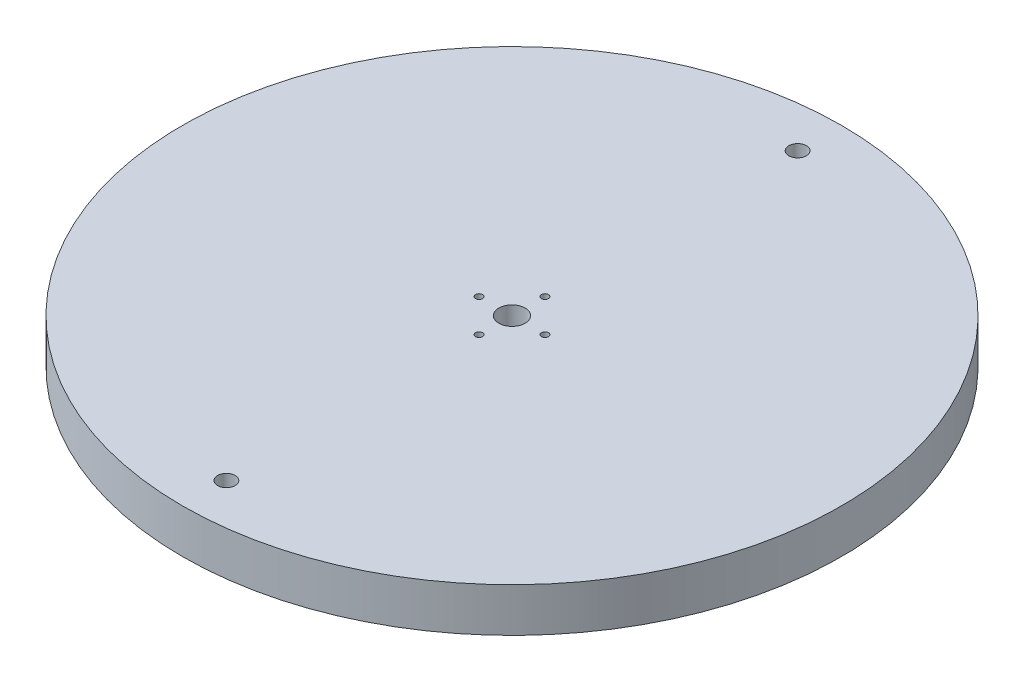
from build123d import *

# Parameters (mm, degrees)
ESQUISSE1_R        = 75
ESQUISSE1_R_2      = 2
ESQUISSE1_R_3      = 0.8
ESQUISSE1_R_4      = 3
BOSS_EXTRU_1_DEPTH = 10


with BuildPart() as part:
    # Esquisse1 → Boss.-Extru.1 (new body)
    with BuildSketch(Plane(origin=(0, 0, 0), x_dir=(1, 0, 0), z_dir=(0, 1, 0))):
        Circle(ESQUISSE1_R)
        with Locations((0, -65)):
            Circle(ESQUISSE1_R_2, mode=Mode.SUBTRACT)
        with Locations((0, 7.5)):
            Circle(ESQUISSE1_R_3, mode=Mode.SUBTRACT)
        with Locations((-7.5, 0)):
            Circle(ESQUISSE1_R_3, mode=Mode.SUBTRACT)
        with Locations((0, -7.5)):
            Circle(ESQUISSE1_R_3, mode=Mode.SUBTRACT)
        with Locations((7.5, 0)):
            Circle(ESQUISSE1_R_3, mode=Mode.SUBTRACT)
        with Locations((0, 65)):
            Circle(ESQUISSE1_R_2, mode=Mode.SUBTRACT)
        Circle(ESQUISSE1_R_4, mode=Mode.SUBTRACT)
    extrude(amount=BOSS_EXTRU_1_DEPTH)


solid = part.part
